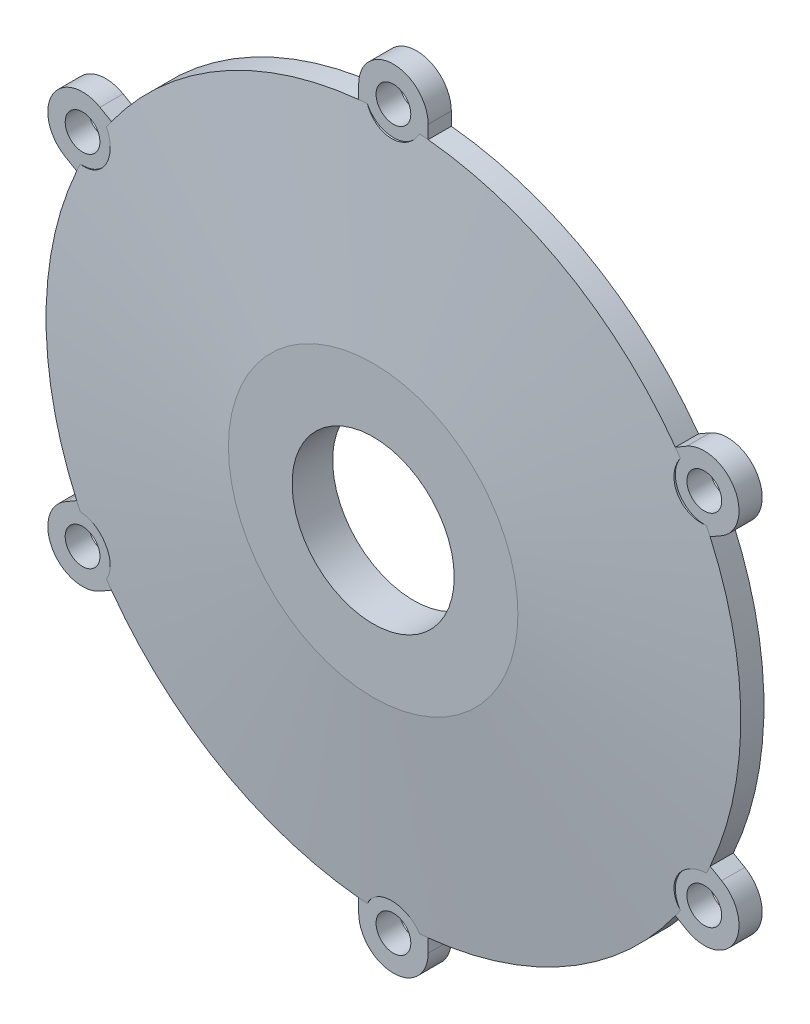
from build123d import *

# Parameters (mm, degrees)
SKETCH1_R           = 57
BOSS_EXTRUDE1_DEPTH = 4
BOSS_EXTRUDE3_START = 1
SKETCH10_R          = 57
BOSS_EXTRUDE3_DEPTH = 1
SKETCH6_R           = 20
BOSS_EXTRUDE2_DEPTH = 2.5
SKETCH4_R           = 14
CUT_EXTRUDE1_DEPTH  = 91.995879028
SKETCH7_R           = 3
CUT_EXTRUDE2_DEPTH  = 91.774445743
SKETCH8_R           = 5
CUT_EXTRUDE3_DEPTH  = 91.774445743
CIRPATTERN1_COUNT   = 6


with BuildPart() as part:
    # Sketch1 → Boss-Extrude1 (new body)
    with BuildSketch(Plane.XY):
        with BuildLine():
            ThreePointArc((6, 62), (0, 68), (-6, 62))
            Line((-6, 62), (-6, 59.699246226))
            ThreePointArc((-6, 59.699246226), (-30, 51.961524227), (-48.701063819, 35.045775536))
            Line((-48.701063819, 35.045775536), (-50.693575035, 36.196152423))
            ThreePointArc((-50.693575035, 36.196152423), (-58.889727457, 34), (-56.693575035, 25.803847577))
            Line((-56.693575035, 25.803847577), (-54.701063819, 24.65347069))
            ThreePointArc((-54.701063819, 24.65347069), (-60, 0), (-54.701063819, -24.65347069))
            Line((-54.701063819, -24.65347069), (-56.693575035, -25.803847577))
            ThreePointArc((-56.693575035, -25.803847577), (-58.889727457, -34), (-50.693575035, -36.196152423))
            Line((-50.693575035, -36.196152423), (-48.701063819, -35.045775536))
            ThreePointArc((-48.701063819, -35.045775536), (-30, -51.961524227), (-6, -59.699246226))
            Line((-6, -59.699246226), (-6, -62))
            ThreePointArc((-6, -62), (0, -68), (6, -62))
            Line((6, -62), (6, -59.699246226))
            ThreePointArc((6, -59.699246226), (30, -51.961524227), (48.701063819, -35.045775536))
            Line((48.701063819, -35.045775536), (50.693575035, -36.196152423))
            ThreePointArc((50.693575035, -36.196152423), (58.889727457, -34), (56.693575035, -25.803847577))
            Line((56.693575035, -25.803847577), (54.701063819, -24.65347069))
            ThreePointArc((54.701063819, -24.65347069), (60, 0), (54.701063819, 24.65347069))
            Line((54.701063819, 24.65347069), (56.693575035, 25.803847577))
            ThreePointArc((56.693575035, 25.803847577), (58.889727457, 34), (50.693575035, 36.196152423))
            Line((50.693575035, 36.196152423), (48.701063819, 35.045775536))
            ThreePointArc((48.701063819, 35.045775536), (30, 51.961524227), (6, 59.699246226))
            Line((6, 59.699246226), (6, 62))
        make_face()
        Circle(SKETCH1_R, mode=Mode.SUBTRACT)
    extrude(amount=BOSS_EXTRUDE1_DEPTH)



with BuildPart() as body_2:
    # Sketch3 → Revolve1 (revolve)
    with BuildSketch(Plane(origin=(0, 0, 0), x_dir=(1, 0, 0), z_dir=(0, 1, 0))):
        Polygon((0, -4), (60, -4), (25, -7.5), (0, -7.5), align=None)
    revolve(axis=Axis((0, 0, 7.5), (0, 0, -1)))


with BuildPart() as part_1:
    add(part.part)

    add(body_2.part)  # Boss-Extrude3 merges body 2
    # Sketch10 → Boss-Extrude3 (add)
    with BuildSketch(Plane(origin=(0, 0, 4), x_dir=(-1, 0, 0), z_dir=(0, 0, -1)).offset(BOSS_EXTRUDE3_START)):
        Circle(SKETCH10_R)
    extrude(amount=-BOSS_EXTRUDE3_DEPTH)

    # Sketch6 → Boss-Extrude2 (add)
    with BuildSketch(Plane(origin=(0, 0, 3), x_dir=(-1, 0, 0), z_dir=(0, 0, -1))):
        Circle(SKETCH6_R)
    extrude(amount=BOSS_EXTRUDE2_DEPTH)

    # Sketch4 → Cut-Extrude1 (cut, through all)
    with BuildSketch(Plane.XY.offset(7.5)):
        Circle(SKETCH4_R)
    extrude(amount=-CUT_EXTRUDE1_DEPTH, mode=Mode.SUBTRACT)

    # Sketch7 → Cut-Extrude2 (cut, through all)
    with BuildSketch(Plane.XY.offset(4)):
        with Locations((0, 62)):
            Circle(SKETCH7_R)
    cut_extrude2 = extrude(amount=-CUT_EXTRUDE2_DEPTH, mode=Mode.SUBTRACT)

    # Sketch8 → Cut-Extrude3 (cut, through all)
    with BuildSketch(Plane.XY.offset(4)):
        with Locations((0, 62)):
            Circle(SKETCH8_R)
    cut_extrude3 = extrude(amount=CUT_EXTRUDE3_DEPTH, mode=Mode.SUBTRACT)

    # CirPattern1: Cut-Extrude2, Cut-Extrude3 ×6 about axis
    cirpattern1_axis = Axis((0, 0, 4), (0, 0, 1))
    add([cut_extrude2.rotate(cirpattern1_axis, i * 360 / CIRPATTERN1_COUNT) for i in range(1, CIRPATTERN1_COUNT)], mode=Mode.SUBTRACT)
    add([cut_extrude3.rotate(cirpattern1_axis, i * 360 / CIRPATTERN1_COUNT) for i in range(1, CIRPATTERN1_COUNT)], mode=Mode.SUBTRACT)


solid = part_1.part
